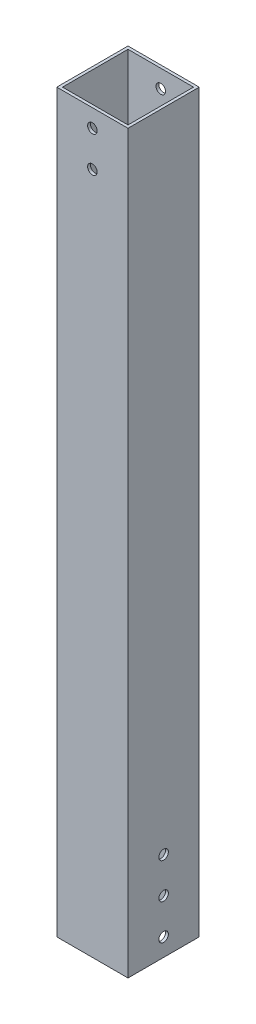
from build123d import *

# Parameters (mm, degrees)
SKETCH1_W              = 38.1
SKETCH1_H              = 38.1
SKETCH1_W_2            = 35.052
SKETCH1_H_2            = 35.052
EXTRUDE_THIN1_DEPTH    = 393.7
F_10_CLEARANCE_HOLE1_D = 5.1054
F_10_CLEARANCE_HOLE2_D = 5.1054


with BuildPart() as part:
    # Sketch1 → Extrude-Thin1 (new body)
    with BuildSketch(Plane(origin=(0, 0, 0), x_dir=(1, 0, 0), z_dir=(0, 1, 0))):
        Rectangle(SKETCH1_W, SKETCH1_H)
        Rectangle(SKETCH1_W_2, SKETCH1_H_2, mode=Mode.SUBTRACT)
    extrude(amount=EXTRUDE_THIN1_DEPTH)

    # #10 Clearance Hole1 (through all)
    with Locations(Plane(origin=(19.05, 0, 0), x_dir=(0, 0, -1), z_dir=(1, 0, 0))):
        with Locations((0, 9.525), (0, 28.575), (0, 47.625)):
            Hole(F_10_CLEARANCE_HOLE1_D / 2)

    # #10 Clearance Hole2 (through all)
    with Locations(Plane.XY.offset(19.05)):
        with Locations((0, 365.125), (0, 384.175)):
            Hole(F_10_CLEARANCE_HOLE2_D / 2)


solid = part.part
